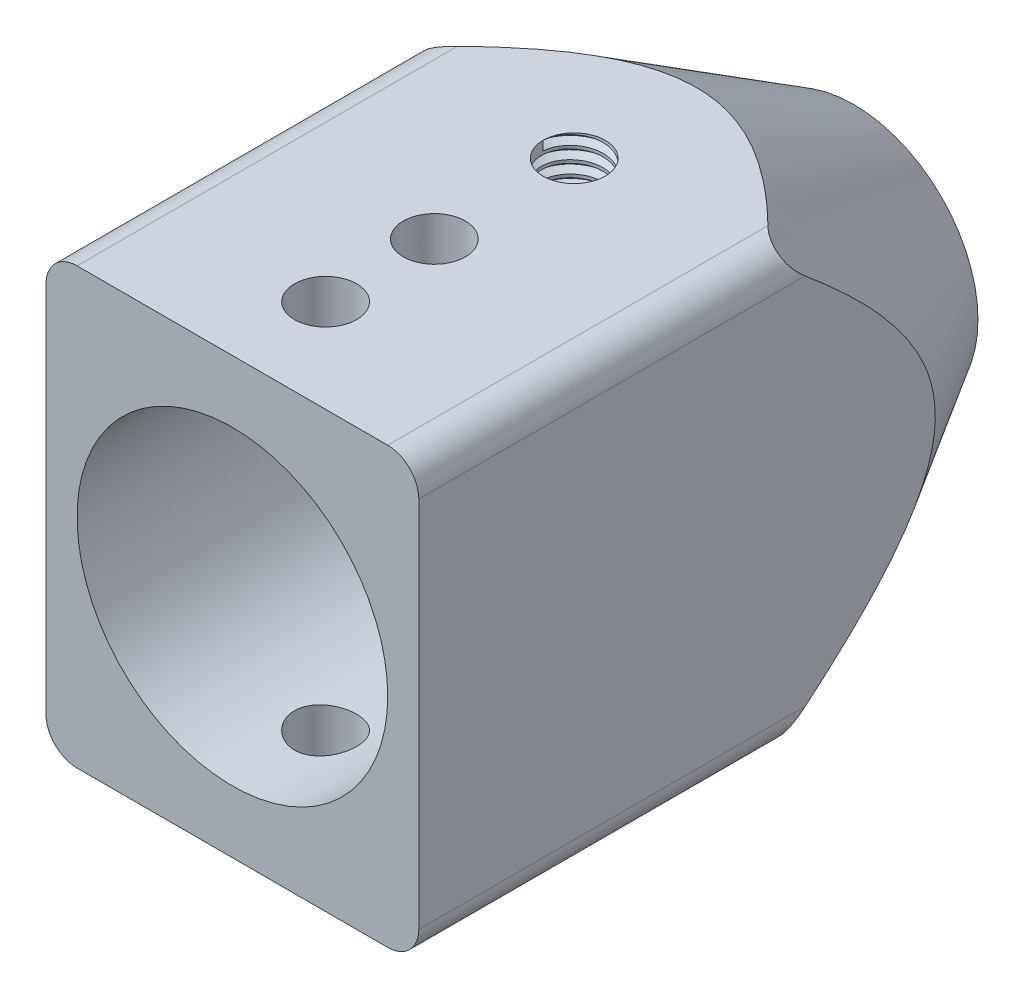
from build123d import *
from build123d.topology import SkipClean

# Parameters (mm, degrees)
SKETCH1_W           = 12
SKETCH1_H           = 14
BOSS_EXTRUDE1_DEPTH = 20
FILLET1_R           = 1
SKETCH3_R           = 1
CUT_EXTRUDE1_DEPTH  = 3
THREAD1_PITCH       = 0.4
SKETCH10_R          = 4
CUT_EXTRUDE2_DEPTH  = 2.5
SKETCH11_R          = 2.5
CUT_EXTRUDE3_DEPTH  = 4
SKETCH12_R          = 5
CUT_EXTRUDE4_DEPTH  = 8
SKETCH13_R          = 1
CUT_EXTRUDE5_DEPTH  = 26.139610339


with BuildPart() as part:
    # Sketch1 → Boss-Extrude1 (new body)
    with BuildSketch(Plane.XY):
        Rectangle(SKETCH1_W, SKETCH1_H)
    extrude(amount=BOSS_EXTRUDE1_DEPTH)

    # Fillet1
    fillet1_edges = [part.edges().sort_by_distance(p)[0] for p in [
        (-6, -7, 10),
        (-6, 7, 10),
        (6, 7, 10),
        (6, -7, 10),
    ]]
    fillet(fillet1_edges, radius=FILLET1_R)

    # Sketch2 → Cut-Revolve2 (revolve, cut)
    with BuildSketch(Plane(origin=(0, 0, 0), x_dir=(0, 0, -1), z_dir=(1, 0, 0)), mode=Mode.PRIVATE) as cut_revolve2_sk:
        Polygon((0, 4), (0, 9.60006016), (-9.445381091, 9.60006016), align=None)
    revolve(cut_revolve2_sk.sketch.rotate(Axis((0, 0, 0), (0, 0, -1)), 90), axis=Axis((0, 0, 0), (0, 0, -1)), mode=Mode.SUBTRACT)

    # Sketch3 → Cut-Extrude1 (cut)
    with BuildSketch(Plane(origin=(0, 7, 0), x_dir=(1, 0, 0), z_dir=(0, 1, 0))):
        with Locations(Location((0, -9, 0), (0, 0, 270))):
            Circle(SKETCH3_R)
    extrude(amount=-CUT_EXTRUDE1_DEPTH, mode=Mode.SUBTRACT)

    # Thread1: the profile of Thread Profile1 profile screwed along a right-hand helix of 6.5 turns, 6 arcs to a turn; built about Z, then put on its axis
    with SkipClean():  # the faces are left unmerged after this step: merging them gives an invalid solid
        thread1_z = Axis((0, 0, 0), (0, 0, 1))
        thread1_corners = [(0.9997, 0, -0.000173205), (1.21650635, 0, 0.124999999), (1.21650635, 0, 0.174999999), (0.9997, 0, 0.300173204)]
        with BuildLine(mode=Mode.PRIVATE) as thread1_profile:
            Line(thread1_corners[0], thread1_corners[1])
            Line(thread1_corners[1], thread1_corners[2])
            Line(thread1_corners[2], thread1_corners[3])
            Line(thread1_corners[3], thread1_corners[0])
        thread1_cap = Face(thread1_profile.wire())
        thread1_turn_angles = [0, 30, 60, 90, 120, 150, 180, 210, 240, 270, 300, 330, 360]
        thread1_turn_weights = [1, 0.8660254037844387, 1, 0.8660254037844387, 1, 0.8660254037844387, 1, 0.8660254037844387, 1, 0.8660254037844387, 1, 0.8660254037844387, 1]
        thread1_turn_rails = [Edge.make_bspline([Vector(p[0], p[1], 0).rotate(thread1_z, thread1_turn_angles[k]) / thread1_turn_weights[k] + Vector(0, 0, p[2] + THREAD1_PITCH * thread1_turn_angles[k] / 360) for k in range(13)], [0, 0, 0, 1, 1, 2, 2, 3, 3, 4, 4, 5, 5, 6, 6, 6], 2, thread1_turn_weights) for p in thread1_corners]
        thread1_turn_sides = [Face.make_surface_from_curves(thread1_turn_rails[p[0]], thread1_turn_rails[p[1]]) for p in [(0, 1), (1, 2), (2, 3), (3, 0)]]
        thread1_last_angles = [2160, 2190, 2220, 2250, 2280, 2310, 2340]
        thread1_last_weights = [1, 0.8660254037844387, 1, 0.8660254037844387, 1, 0.8660254037844387, 1]
        thread1_last_rails = [Edge.make_bspline([Vector(p[0], p[1], 0).rotate(thread1_z, thread1_last_angles[k]) / thread1_last_weights[k] + Vector(0, 0, p[2] + THREAD1_PITCH * thread1_last_angles[k] / 360) for k in range(7)], [0, 0, 0, 1, 1, 2, 2, 3, 3, 3], 2, thread1_last_weights) for p in thread1_corners]
        thread1_last_sides = [Face.make_surface_from_curves(thread1_last_rails[p[0]], thread1_last_rails[p[1]]) for p in [(0, 1), (1, 2), (2, 3), (3, 0)]]
        thread1 = Plane(origin=(0, 7, 9), x_dir=(-1, 0, 0), z_dir=(0, -1, 0)) * Solid(Shell([*[p.moved(Location((0, 0, THREAD1_PITCH * i))) for i in range(6) for p in thread1_turn_sides], *thread1_last_sides, thread1_cap, thread1_cap.rotate(thread1_z, 2340).moved(Location((0, 0, THREAD1_PITCH * 2340 / 360)))]))
        add(thread1, mode=Mode.SUBTRACT)

    # Sketch10 → Cut-Extrude2 (cut)
    with SkipClean():  # the faces are left unmerged after this step: merging them gives an invalid solid
        with BuildSketch(Plane(origin=(0, 0, 0), x_dir=(-1, 0, 0), z_dir=(0, 0, -1))):
            Circle(SKETCH10_R)
        extrude(amount=-CUT_EXTRUDE2_DEPTH, mode=Mode.SUBTRACT)

    # Sketch11 → Cut-Extrude3 (cut)
    with SkipClean():  # the faces are left unmerged after this step: merging them gives an invalid solid
        with BuildSketch(Plane(origin=(0, 0, 2.5), x_dir=(-1, 0, 0), z_dir=(0, 0, -1))):
            Circle(SKETCH11_R)
        extrude(amount=-CUT_EXTRUDE3_DEPTH, mode=Mode.SUBTRACT)

    # Sketch12 → Cut-Extrude4 (cut)
    with SkipClean():  # the faces are left unmerged after this step: merging them gives an invalid solid
        with BuildSketch(Plane.XY.offset(20)):
            Circle(SKETCH12_R)
        extrude(amount=-CUT_EXTRUDE4_DEPTH, mode=Mode.SUBTRACT)

    # Sketch13 → Cut-Extrude5 (cut, through all)
    with SkipClean():  # the faces are left unmerged after this step: merging them gives an invalid solid
        with BuildSketch(Plane(origin=(0, 7, 0), x_dir=(1, 0, 0), z_dir=(0, 1, 0))):
            with Locations(Location((0, -13.5, 0), (0, 0, 270))):
                Circle(SKETCH13_R)
            with Locations(Location((0, -17, 0), (0, 0, 270))):
                Circle(SKETCH13_R)
        extrude(amount=-CUT_EXTRUDE5_DEPTH, mode=Mode.SUBTRACT)


solid = part.part
